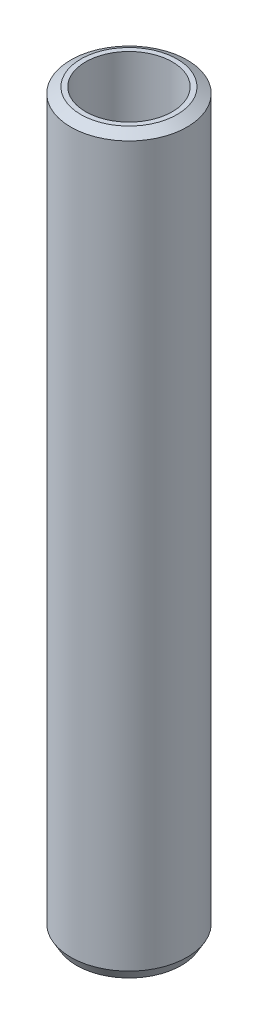
from build123d import *
from OCP.BRepFilletAPI import BRepFilletAPI_MakeChamfer

# Parameters (mm, degrees)
SKETCH1_R           = 47.5
BOSS_EXTRUDE1_DEPTH = 600
SKETCH2_R           = 35.349302469
CUT_EXTRUDE1_DEPTH  = 604.748706003
CHAMFER1_SIZE       = 4.735111448
CHAMFER1_SIZE2      = 8.201453607


with BuildPart() as part:
    # Sketch1 → Boss-Extrude1 (new body)
    with BuildSketch(Plane(origin=(0, 0, 0), x_dir=(1, 0, 0), z_dir=(0, 1, 0))):
        Circle(SKETCH1_R)
    extrude(amount=BOSS_EXTRUDE1_DEPTH)

    # Sketch2 → Cut-Extrude1 (cut, through all)
    with BuildSketch(Plane(origin=(0, 0, 0), x_dir=(1, 0, 0), z_dir=(0, 1, 0))):
        Circle(SKETCH2_R)
    extrude(amount=CUT_EXTRUDE1_DEPTH, mode=Mode.SUBTRACT)

    # Chamfer1: one chamfer whose edges measure the first distance from different faces: ONE call of the kernel's chamfer builder (chamfer() names one face for all edges)
    chamfer1_edges_1 = [part.edges().sort_by_distance(p)[0] for p in [
        (-47.5, 600, 0),
    ]]
    chamfer1_side_1 = [part.faces().sort_by_distance(p)[0] for p in [
        (-47.5, 300, 0),
    ]]
    chamfer1_edges_2 = [part.edges().sort_by_distance(p)[0] for p in [
        (-47.5, 0, 0),
    ]]
    chamfer1_side_2 = [part.faces().sort_by_distance(p)[0] for p in [
        (-46.156497116, 0, 0),
    ]]
    chamfer1 = BRepFilletAPI_MakeChamfer(part.part.solid().wrapped)
    for e in chamfer1_edges_1:
        chamfer1.Add(CHAMFER1_SIZE, CHAMFER1_SIZE2, e.wrapped, chamfer1_side_1[0].wrapped)  # the first distance lies on this face
    for e in chamfer1_edges_2:
        chamfer1.Add(CHAMFER1_SIZE, CHAMFER1_SIZE2, e.wrapped, chamfer1_side_2[0].wrapped)  # the first distance lies on this face
    add(Compound.cast(chamfer1.Shape()), mode=Mode.REPLACE)


solid = part.part
